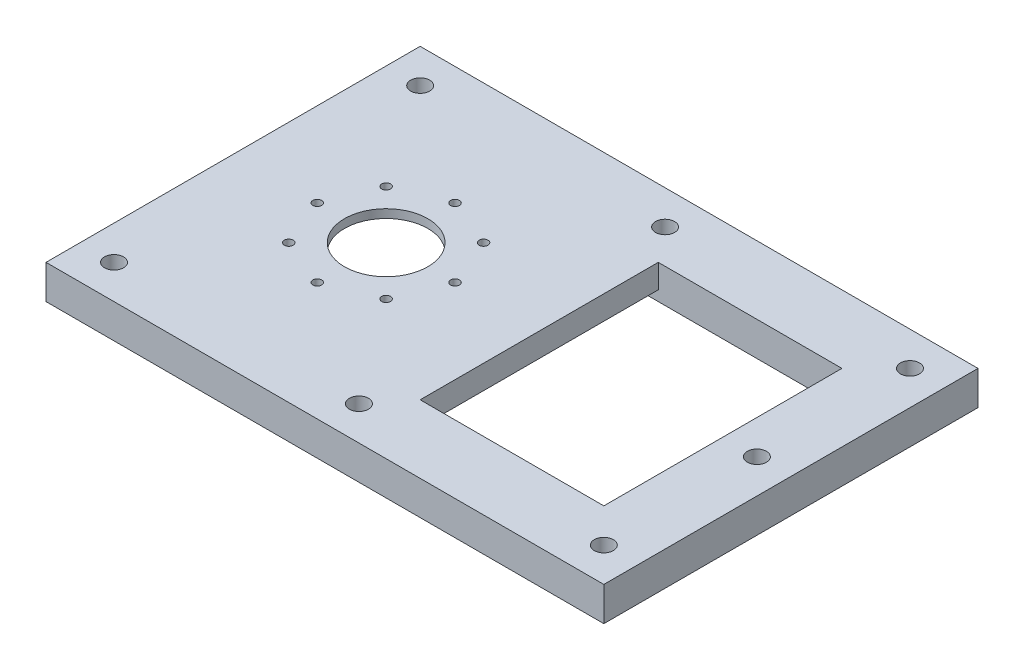
from build123d import *

# Parameters (mm, degrees)
SKETCH1_R           = 35
SKETCH1_R_2         = 12.25
BOSS_EXTRUDE1_DEPTH = 2.5
BOSS_EXTRUDE2_START = 2
SKETCH3_R           = 35
SKETCH3_R_2         = 18.6
BOSS_EXTRUDE2_DEPTH = 2
BOSS_EXTRUDE3_START = 2
SKETCH4_R           = 35
SKETCH4_R_2         = 22.3
BOSS_EXTRUDE3_DEPTH = 2
CUT_EXTRUDE1_REACH  = 51.922
SKETCH6_R           = 1.3
BOSS_EXTRUDE6_START = -10
SKETCH7_R           = 35
SKETCH7_W           = 54
SKETCH7_H           = 70
BOSS_EXTRUDE6_DEPTH = 10
SKETCH8_W           = 7
SKETCH8_H           = 70
CUT_EXTRUDE3_DEPTH  = 3
CUT_EXTRUDE4_REACH  = 133.476
SKETCH10_R          = 2.8


with BuildPart() as part:
    # Sketch1 → Boss-Extrude1 (new body)
    with BuildSketch(Plane(origin=(0, 0, 0), x_dir=(1, 0, 0), z_dir=(0, 1, 0))):
        Circle(SKETCH1_R)
        Circle(SKETCH1_R_2, mode=Mode.SUBTRACT)
    extrude(amount=BOSS_EXTRUDE1_DEPTH)

    # Sketch3 → Boss-Extrude2 (add)
    with BuildSketch(Plane.XZ.offset(BOSS_EXTRUDE2_START)):
        Circle(SKETCH3_R)
        Circle(SKETCH3_R_2, mode=Mode.SUBTRACT)
    extrude(amount=-BOSS_EXTRUDE2_DEPTH)

    # Sketch4 → Boss-Extrude3 (add)
    with BuildSketch(Plane.XZ.offset(2).offset(BOSS_EXTRUDE3_START)):
        Circle(SKETCH4_R)
        Circle(SKETCH4_R_2, mode=Mode.SUBTRACT)
    extrude(amount=-BOSS_EXTRUDE3_DEPTH)

    # Sketch6 → Cut-Extrude1 (cut, up to next)
    with BuildSketch(Plane(origin=(0, 2.5, 0), x_dir=(1, 0, 0), z_dir=(0, 1, 0)), mode=Mode.PRIVATE) as cut_extrude1_sk1:
        with Locations((0, 20.25)):
            Circle(SKETCH6_R)
    cut_extrude1_tool1 = extrude(cut_extrude1_sk1.sketch, amount=-CUT_EXTRUDE1_REACH, mode=Mode.PRIVATE) & part.part
    # Sketch6 → Cut-Extrude1 (cut, up to next)
    with BuildSketch(Plane(origin=(0, 2.5, 0), x_dir=(1, 0, 0), z_dir=(0, 1, 0)), mode=Mode.PRIVATE) as cut_extrude1_sk2:
        with Locations((14.318912319, 14.318912319)):
            Circle(SKETCH6_R)
    cut_extrude1_tool2 = extrude(cut_extrude1_sk2.sketch, amount=-CUT_EXTRUDE1_REACH, mode=Mode.PRIVATE) & part.part
    # Sketch6 → Cut-Extrude1 (cut, up to next)
    with BuildSketch(Plane(origin=(0, 2.5, 0), x_dir=(1, 0, 0), z_dir=(0, 1, 0)), mode=Mode.PRIVATE) as cut_extrude1_sk3:
        with Locations((20.25, 0)):
            Circle(SKETCH6_R)
    cut_extrude1_tool3 = extrude(cut_extrude1_sk3.sketch, amount=-CUT_EXTRUDE1_REACH, mode=Mode.PRIVATE) & part.part
    # Sketch6 → Cut-Extrude1 (cut, up to next)
    with BuildSketch(Plane(origin=(0, 2.5, 0), x_dir=(1, 0, 0), z_dir=(0, 1, 0)), mode=Mode.PRIVATE) as cut_extrude1_sk4:
        with Locations((14.318912319, -14.318912319)):
            Circle(SKETCH6_R)
    cut_extrude1_tool4 = extrude(cut_extrude1_sk4.sketch, amount=-CUT_EXTRUDE1_REACH, mode=Mode.PRIVATE) & part.part
    # Sketch6 → Cut-Extrude1 (cut, up to next)
    with BuildSketch(Plane(origin=(0, 2.5, 0), x_dir=(1, 0, 0), z_dir=(0, 1, 0)), mode=Mode.PRIVATE) as cut_extrude1_sk5:
        with Locations((0, -20.25)):
            Circle(SKETCH6_R)
    cut_extrude1_tool5 = extrude(cut_extrude1_sk5.sketch, amount=-CUT_EXTRUDE1_REACH, mode=Mode.PRIVATE) & part.part
    # Sketch6 → Cut-Extrude1 (cut, up to next)
    with BuildSketch(Plane(origin=(0, 2.5, 0), x_dir=(1, 0, 0), z_dir=(0, 1, 0)), mode=Mode.PRIVATE) as cut_extrude1_sk6:
        with Locations((-14.318912319, -14.318912319)):
            Circle(SKETCH6_R)
    cut_extrude1_tool6 = extrude(cut_extrude1_sk6.sketch, amount=-CUT_EXTRUDE1_REACH, mode=Mode.PRIVATE) & part.part
    # Sketch6 → Cut-Extrude1 (cut, up to next)
    with BuildSketch(Plane(origin=(0, 2.5, 0), x_dir=(1, 0, 0), z_dir=(0, 1, 0)), mode=Mode.PRIVATE) as cut_extrude1_sk7:
        with Locations((-20.25, 0)):
            Circle(SKETCH6_R)
    cut_extrude1_tool7 = extrude(cut_extrude1_sk7.sketch, amount=-CUT_EXTRUDE1_REACH, mode=Mode.PRIVATE) & part.part
    # Sketch6 → Cut-Extrude1 (cut, up to next)
    with BuildSketch(Plane(origin=(0, 2.5, 0), x_dir=(1, 0, 0), z_dir=(0, 1, 0)), mode=Mode.PRIVATE) as cut_extrude1_sk8:
        with Locations((-14.318912319, 14.318912319)):
            Circle(SKETCH6_R)
    cut_extrude1_tool8 = extrude(cut_extrude1_sk8.sketch, amount=-CUT_EXTRUDE1_REACH, mode=Mode.PRIVATE) & part.part
    add(cut_extrude1_tool1.solids().sort_by_distance((0, 2.5, -20.25))[0], mode=Mode.SUBTRACT)
    add(cut_extrude1_tool2.solids().sort_by_distance((14.318912, 2.5, -14.318912))[0], mode=Mode.SUBTRACT)
    add(cut_extrude1_tool3.solids().sort_by_distance((20.25, 2.5, 0))[0], mode=Mode.SUBTRACT)
    add(cut_extrude1_tool4.solids().sort_by_distance((14.318912, 2.5, 14.318912))[0], mode=Mode.SUBTRACT)
    add(cut_extrude1_tool5.solids().sort_by_distance((0, 2.5, 20.25))[0], mode=Mode.SUBTRACT)
    add(cut_extrude1_tool6.solids().sort_by_distance((-14.318912, 2.5, 14.318912))[0], mode=Mode.SUBTRACT)
    add(cut_extrude1_tool7.solids().sort_by_distance((-20.25, 2.5, 0))[0], mode=Mode.SUBTRACT)
    add(cut_extrude1_tool8.solids().sort_by_distance((-14.318912, 2.5, -14.318912))[0], mode=Mode.SUBTRACT)

    # Sketch7 → Boss-Extrude6 (add)
    with BuildSketch(Plane(origin=(0, 2.5, 0), x_dir=(1, 0, 0), z_dir=(0, 1, 0)).offset(BOSS_EXTRUDE6_START)):
        Polygon((99, 55), (-45, 55), (-45, 35), (-45, -55), (-35, -55), (99, -55), (119, -55), (119, 55), align=None)
        Circle(SKETCH7_R, mode=Mode.SUBTRACT)
        with Locations((72, 0)):
            Rectangle(SKETCH7_W, SKETCH7_H, mode=Mode.SUBTRACT)
    extrude(amount=BOSS_EXTRUDE6_DEPTH)

    # Sketch8 → Cut-Extrude3 (cut)
    with BuildSketch(Plane.XZ.offset(7.5)):
        with Locations((41.5, 0)):
            Rectangle(SKETCH8_W, SKETCH8_H)
        with Locations((102.5, 0)):
            Rectangle(SKETCH8_W, SKETCH8_H)
    extrude(amount=-CUT_EXTRUDE3_DEPTH, mode=Mode.SUBTRACT)

    # Sketch10 → Cut-Extrude4 (cut, up to next)
    with BuildSketch(Plane(origin=(0, 2.5, 0), x_dir=(1, 0, 0), z_dir=(0, 1, 0)), mode=Mode.PRIVATE) as cut_extrude4_sk1:
        with Locations((37, 45)):
            Circle(SKETCH10_R)
    cut_extrude4_tool1 = extrude(cut_extrude4_sk1.sketch, amount=-CUT_EXTRUDE4_REACH, mode=Mode.PRIVATE) & part.part
    # Sketch10 → Cut-Extrude4 (cut, up to next)
    with BuildSketch(Plane(origin=(0, 2.5, 0), x_dir=(1, 0, 0), z_dir=(0, 1, 0)), mode=Mode.PRIVATE) as cut_extrude4_sk2:
        with Locations((-35, 45)):
            Circle(SKETCH10_R)
    cut_extrude4_tool2 = extrude(cut_extrude4_sk2.sketch, amount=-CUT_EXTRUDE4_REACH, mode=Mode.PRIVATE) & part.part
    # Sketch10 → Cut-Extrude4 (cut, up to next)
    with BuildSketch(Plane(origin=(0, 2.5, 0), x_dir=(1, 0, 0), z_dir=(0, 1, 0)), mode=Mode.PRIVATE) as cut_extrude4_sk3:
        with Locations((-35, -45)):
            Circle(SKETCH10_R)
    cut_extrude4_tool3 = extrude(cut_extrude4_sk3.sketch, amount=-CUT_EXTRUDE4_REACH, mode=Mode.PRIVATE) & part.part
    # Sketch10 → Cut-Extrude4 (cut, up to next)
    with BuildSketch(Plane(origin=(0, 2.5, 0), x_dir=(1, 0, 0), z_dir=(0, 1, 0)), mode=Mode.PRIVATE) as cut_extrude4_sk4:
        with Locations((37, -45)):
            Circle(SKETCH10_R)
    cut_extrude4_tool4 = extrude(cut_extrude4_sk4.sketch, amount=-CUT_EXTRUDE4_REACH, mode=Mode.PRIVATE) & part.part
    # Sketch10 → Cut-Extrude4 (cut, up to next)
    with BuildSketch(Plane(origin=(0, 2.5, 0), x_dir=(1, 0, 0), z_dir=(0, 1, 0)), mode=Mode.PRIVATE) as cut_extrude4_sk5:
        with Locations((109, 45)):
            Circle(SKETCH10_R)
    cut_extrude4_tool5 = extrude(cut_extrude4_sk5.sketch, amount=-CUT_EXTRUDE4_REACH, mode=Mode.PRIVATE) & part.part
    # Sketch10 → Cut-Extrude4 (cut, up to next)
    with BuildSketch(Plane(origin=(0, 2.5, 0), x_dir=(1, 0, 0), z_dir=(0, 1, 0)), mode=Mode.PRIVATE) as cut_extrude4_sk6:
        with Locations((109, -45)):
            Circle(SKETCH10_R)
    cut_extrude4_tool6 = extrude(cut_extrude4_sk6.sketch, amount=-CUT_EXTRUDE4_REACH, mode=Mode.PRIVATE) & part.part
    # Sketch10 → Cut-Extrude4 (cut, up to next)
    with BuildSketch(Plane(origin=(0, 2.5, 0), x_dir=(1, 0, 0), z_dir=(0, 1, 0)), mode=Mode.PRIVATE) as cut_extrude4_sk7:
        with Locations((109, 0)):
            Circle(SKETCH10_R)
    cut_extrude4_tool7 = extrude(cut_extrude4_sk7.sketch, amount=-CUT_EXTRUDE4_REACH, mode=Mode.PRIVATE) & part.part
    add(cut_extrude4_tool1.solids().sort_by_distance((37, 2.5, -45))[0], mode=Mode.SUBTRACT)
    add(cut_extrude4_tool2.solids().sort_by_distance((-35, 2.5, -45))[0], mode=Mode.SUBTRACT)
    add(cut_extrude4_tool3.solids().sort_by_distance((-35, 2.5, 45))[0], mode=Mode.SUBTRACT)
    add(cut_extrude4_tool4.solids().sort_by_distance((37, 2.5, 45))[0], mode=Mode.SUBTRACT)
    add(cut_extrude4_tool5.solids().sort_by_distance((109, 2.5, -45))[0], mode=Mode.SUBTRACT)
    add(cut_extrude4_tool6.solids().sort_by_distance((109, 2.5, 45))[0], mode=Mode.SUBTRACT)
    add(cut_extrude4_tool7.solids().sort_by_distance((109, 2.5, 0))[0], mode=Mode.SUBTRACT)


solid = part.part
